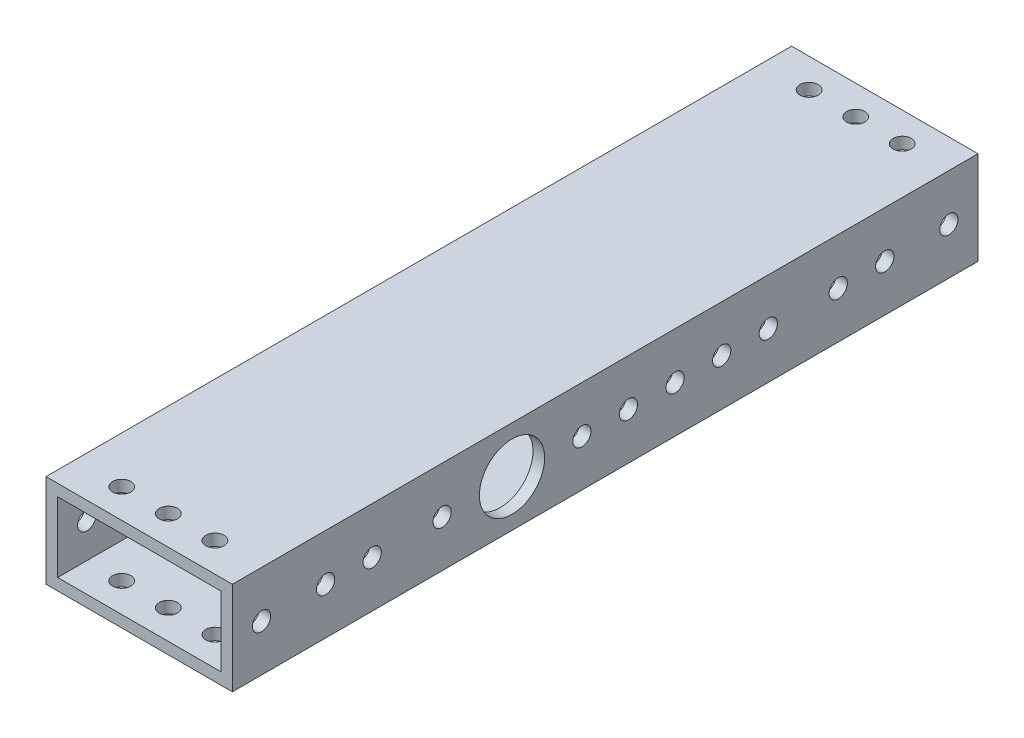
from build123d import *

# Parameters (mm, degrees)
SKETCH1_W           = 50.8
SKETCH1_H           = 25.4
SKETCH1_W_2         = 44.45
SKETCH1_H_2         = 19.05
BOSS_EXTRUDE1_DEPTH = 101.6
SKETCH3_R           = 2.4892
CUT_EXTRUDE2_DEPTH  = 108.763073453
SKETCH4_R           = 8.89
SKETCH4_R_2         = 2.4892
CUT_EXTRUDE3_DEPTH  = 115.3
SKETCH2_R           = 2.4892
CUT_EXTRUDE1_DEPTH  = 115.3
CUT_EXTRUDE4_REACH  = 109.763
SKETCH5_R           = 2.4892
CUT_EXTRUDE5_REACH  = 116.3
SKETCH7_R           = 2.4892


with BuildPart() as part:
    # Sketch1 → Boss-Extrude1 (new, symmetric)
    with BuildSketch(Plane.XY):
        Rectangle(SKETCH1_W, SKETCH1_H)
        Rectangle(SKETCH1_W_2, SKETCH1_H_2, mode=Mode.SUBTRACT)
    extrude(amount=BOSS_EXTRUDE1_DEPTH, both=True)

    # Sketch3 → Cut-Extrude2 (cut, through all)
    with BuildSketch(Plane(origin=(0, 12.7, 0), x_dir=(1, 0, 0), z_dir=(0, 1, 0))):
        with Locations((-12.7, -93.6625)):
            Circle(SKETCH3_R)
        with Locations((0, -93.6625)):
            Circle(SKETCH3_R)
        with Locations((12.7, -93.6625)):
            Circle(SKETCH3_R)
        with Locations((12.7, 93.6625)):
            Circle(SKETCH3_R)
        with Locations((0, 93.6625)):
            Circle(SKETCH3_R)
        with Locations((-12.7, 93.6625)):
            Circle(SKETCH3_R)
    extrude(amount=-CUT_EXTRUDE2_DEPTH, mode=Mode.SUBTRACT)

    # Sketch4 → Cut-Extrude3 (cut, through all)
    with BuildSketch(Plane(origin=(25.4, 0, 0), x_dir=(0, 0, -1), z_dir=(1, 0, 0))):
        with Locations((-25.4, 0)):
            Circle(SKETCH4_R)
        with Locations((31.75, 0)):
            Circle(SKETCH4_R_2)
        with Locations((19.05, 0)):
            Circle(SKETCH4_R_2)
    extrude(amount=-CUT_EXTRUDE3_DEPTH, mode=Mode.SUBTRACT)

    # Sketch2 → Cut-Extrude1 (cut, through all)
    with BuildSketch(Plane(origin=(25.4, 0, 0), x_dir=(0, 0, -1), z_dir=(1, 0, 0))):
        with Locations((-93.6625, 0)):
            Circle(SKETCH2_R)
        with Locations((93.6625, 0)):
            Circle(SKETCH2_R)
        with Locations((-76.2, 0)):
            Circle(SKETCH2_R)
        with Locations((-63.5, 0)):
            Circle(SKETCH2_R)
        with Locations((63.5, 0)):
            Circle(SKETCH2_R)
        with Locations((76.2, 0)):
            Circle(SKETCH2_R)
    extrude(amount=-CUT_EXTRUDE1_DEPTH, mode=Mode.SUBTRACT)

    # Sketch5 → Cut-Extrude4 (cut, up to next)
    with BuildSketch(Plane.XZ.offset(12.7), mode=Mode.PRIVATE) as cut_extrude4_sk1:
        with Locations((-3.175, 66.675)):
            Circle(SKETCH5_R)
    cut_extrude4_tool1 = extrude(cut_extrude4_sk1.sketch, amount=-CUT_EXTRUDE4_REACH, mode=Mode.PRIVATE) & part.part
    # Sketch5 → Cut-Extrude4 (cut, up to next)
    with BuildSketch(Plane.XZ.offset(12.7), mode=Mode.PRIVATE) as cut_extrude4_sk2:
        with Locations((-15.875, 66.675)):
            Circle(SKETCH5_R)
    cut_extrude4_tool2 = extrude(cut_extrude4_sk2.sketch, amount=-CUT_EXTRUDE4_REACH, mode=Mode.PRIVATE) & part.part
    # Sketch5 → Cut-Extrude4 (cut, up to next)
    with BuildSketch(Plane.XZ.offset(12.7), mode=Mode.PRIVATE) as cut_extrude4_sk3:
        with Locations((-15.875, 53.975)):
            Circle(SKETCH5_R)
    cut_extrude4_tool3 = extrude(cut_extrude4_sk3.sketch, amount=-CUT_EXTRUDE4_REACH, mode=Mode.PRIVATE) & part.part
    # Sketch5 → Cut-Extrude4 (cut, up to next)
    with BuildSketch(Plane.XZ.offset(12.7), mode=Mode.PRIVATE) as cut_extrude4_sk4:
        with Locations((-3.175, 53.975)):
            Circle(SKETCH5_R)
    cut_extrude4_tool4 = extrude(cut_extrude4_sk4.sketch, amount=-CUT_EXTRUDE4_REACH, mode=Mode.PRIVATE) & part.part
    # Sketch5 → Cut-Extrude4 (cut, up to next)
    with BuildSketch(Plane.XZ.offset(12.7), mode=Mode.PRIVATE) as cut_extrude4_sk5:
        with Locations((-3.175, -9.525)):
            Circle(SKETCH5_R)
    cut_extrude4_tool5 = extrude(cut_extrude4_sk5.sketch, amount=-CUT_EXTRUDE4_REACH, mode=Mode.PRIVATE) & part.part
    # Sketch5 → Cut-Extrude4 (cut, up to next)
    with BuildSketch(Plane.XZ.offset(12.7), mode=Mode.PRIVATE) as cut_extrude4_sk6:
        with Locations((-15.875, -9.525)):
            Circle(SKETCH5_R)
    cut_extrude4_tool6 = extrude(cut_extrude4_sk6.sketch, amount=-CUT_EXTRUDE4_REACH, mode=Mode.PRIVATE) & part.part
    # Sketch5 → Cut-Extrude4 (cut, up to next)
    with BuildSketch(Plane.XZ.offset(12.7), mode=Mode.PRIVATE) as cut_extrude4_sk7:
        with Locations((-15.875, -22.225)):
            Circle(SKETCH5_R)
    cut_extrude4_tool7 = extrude(cut_extrude4_sk7.sketch, amount=-CUT_EXTRUDE4_REACH, mode=Mode.PRIVATE) & part.part
    # Sketch5 → Cut-Extrude4 (cut, up to next)
    with BuildSketch(Plane.XZ.offset(12.7), mode=Mode.PRIVATE) as cut_extrude4_sk8:
        with Locations((-3.175, -22.225)):
            Circle(SKETCH5_R)
    cut_extrude4_tool8 = extrude(cut_extrude4_sk8.sketch, amount=-CUT_EXTRUDE4_REACH, mode=Mode.PRIVATE) & part.part
    add(cut_extrude4_tool1.solids().sort_by_distance((-3.175, -12.7, 66.675))[0], mode=Mode.SUBTRACT)
    add(cut_extrude4_tool2.solids().sort_by_distance((-15.875, -12.7, 66.675))[0], mode=Mode.SUBTRACT)
    add(cut_extrude4_tool3.solids().sort_by_distance((-15.875, -12.7, 53.975))[0], mode=Mode.SUBTRACT)
    add(cut_extrude4_tool4.solids().sort_by_distance((-3.175, -12.7, 53.975))[0], mode=Mode.SUBTRACT)
    add(cut_extrude4_tool5.solids().sort_by_distance((-3.175, -12.7, -9.525))[0], mode=Mode.SUBTRACT)
    add(cut_extrude4_tool6.solids().sort_by_distance((-15.875, -12.7, -9.525))[0], mode=Mode.SUBTRACT)
    add(cut_extrude4_tool7.solids().sort_by_distance((-15.875, -12.7, -22.225))[0], mode=Mode.SUBTRACT)
    add(cut_extrude4_tool8.solids().sort_by_distance((-3.175, -12.7, -22.225))[0], mode=Mode.SUBTRACT)

    # Sketch7 → Cut-Extrude5 (cut, up to next)
    with BuildSketch(Plane(origin=(25.4, 0, 0), x_dir=(0, 0, -1), z_dir=(1, 0, 0)), mode=Mode.PRIVATE) as cut_extrude5_sk1:
        with Locations((44.45, 0)):
            Circle(SKETCH7_R)
    cut_extrude5_tool1 = extrude(cut_extrude5_sk1.sketch, amount=-CUT_EXTRUDE5_REACH, mode=Mode.PRIVATE) & part.part
    # Sketch7 → Cut-Extrude5 (cut, up to next)
    with BuildSketch(Plane(origin=(25.4, 0, 0), x_dir=(0, 0, -1), z_dir=(1, 0, 0)), mode=Mode.PRIVATE) as cut_extrude5_sk2:
        with Locations((6.35, 0)):
            Circle(SKETCH7_R)
    cut_extrude5_tool2 = extrude(cut_extrude5_sk2.sketch, amount=-CUT_EXTRUDE5_REACH, mode=Mode.PRIVATE) & part.part
    # Sketch7 → Cut-Extrude5 (cut, up to next)
    with BuildSketch(Plane(origin=(25.4, 0, 0), x_dir=(0, 0, -1), z_dir=(1, 0, 0)), mode=Mode.PRIVATE) as cut_extrude5_sk3:
        with Locations((-6.35, 0)):
            Circle(SKETCH7_R)
    cut_extrude5_tool3 = extrude(cut_extrude5_sk3.sketch, amount=-CUT_EXTRUDE5_REACH, mode=Mode.PRIVATE) & part.part
    # Sketch7 → Cut-Extrude5 (cut, up to next)
    with BuildSketch(Plane(origin=(25.4, 0, 0), x_dir=(0, 0, -1), z_dir=(1, 0, 0)), mode=Mode.PRIVATE) as cut_extrude5_sk4:
        with Locations((-44.45, 0)):
            Circle(SKETCH7_R)
    cut_extrude5_tool4 = extrude(cut_extrude5_sk4.sketch, amount=-CUT_EXTRUDE5_REACH, mode=Mode.PRIVATE) & part.part
    add(cut_extrude5_tool1.solids().sort_by_distance((25.4, 0, -44.45))[0], mode=Mode.SUBTRACT)
    add(cut_extrude5_tool2.solids().sort_by_distance((25.4, 0, -6.35))[0], mode=Mode.SUBTRACT)
    add(cut_extrude5_tool3.solids().sort_by_distance((25.4, 0, 6.35))[0], mode=Mode.SUBTRACT)
    add(cut_extrude5_tool4.solids().sort_by_distance((25.4, 0, 44.45))[0], mode=Mode.SUBTRACT)


solid = part.part
